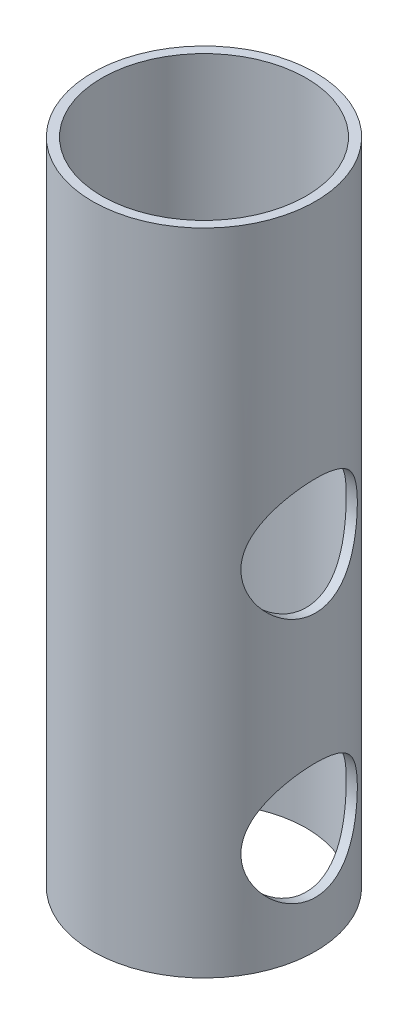
from build123d import *

# Parameters (mm, degrees)
SKETCH1_R           = 24
SKETCH1_R_2         = 22
BOSS_EXTRUDE1_DEPTH = 139.8
SKETCH2_R           = 12.53
CUT_EXTRUDE1_DEPTH  = 144.86118309


with BuildPart() as part:
    # Sketch1 → Boss-Extrude1 (new body)
    with BuildSketch(Plane(origin=(0, 0, 0), x_dir=(1, 0, 0), z_dir=(0, 1, 0))):
        Circle(SKETCH1_R)
        Circle(SKETCH1_R_2, mode=Mode.SUBTRACT)
    extrude(amount=BOSS_EXTRUDE1_DEPTH)

    # Sketch2 → Cut-Extrude1 (cut, through all)
    with BuildSketch(Plane(origin=(0, 0, 0), x_dir=(0, 0, -1), z_dir=(1, 0, 0))):
        with Locations((0, 22.6)):
            Circle(SKETCH2_R)
        with Locations((0, 75.6)):
            Circle(SKETCH2_R)
    extrude(amount=CUT_EXTRUDE1_DEPTH, mode=Mode.SUBTRACT)


solid = part.part
